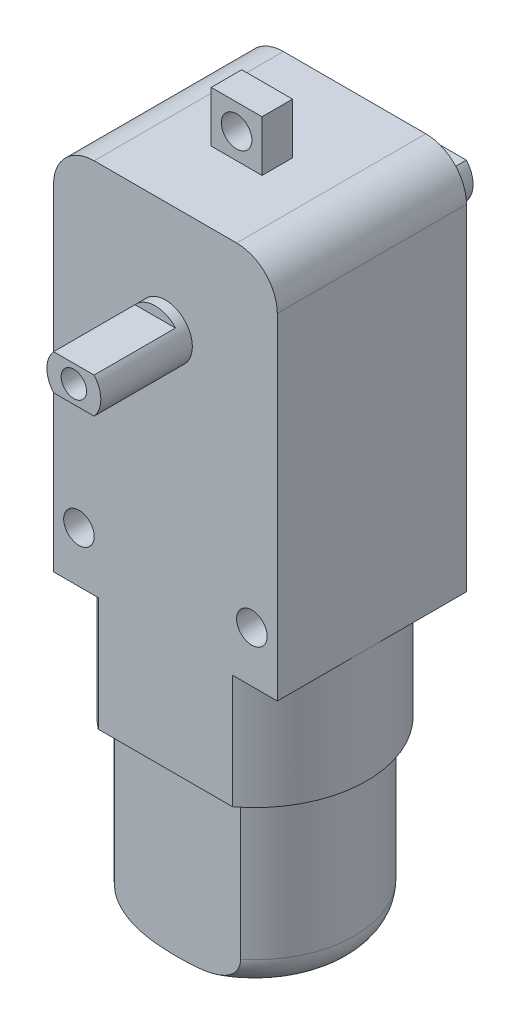
from build123d import *

# Parameters (mm, degrees)
SKETCH1_W                = 22
SKETCH1_H                = 65
BOSS_EXTRUDE1_DEPTH      = 18.6
FILLET1_R                = 4
BOSS_EXTRUDE2_DEPTH      = 9
BOSS_EXTRUDE2_DEPTH_BACK = 27.6
SKETCH2_R                = 2.65
CUT_EXTRUDE1_DEPTH       = 8
CUT_EXTRUDE2_DEPTH       = 8
SKETCH5_R                = 1.25
CUT_EXTRUDE3_DEPTH       = 51.16781837
BOSS_EXTRUDE3_START      = -7
SKETCH6_W                = 5
SKETCH6_H                = 10
SKETCH6_R                = 1.5
BOSS_EXTRUDE3_DEPTH      = 3
SKETCH7_R                = 2.85
SKETCH7_R_2              = 2.65
BOSS_EXTRUDE4_DEPTH      = 0.5
SKETCH8_R                = 2
BOSS_EXTRUDE5_DEPTH      = 2
SKETCH9_R                = 1.5
CUT_EXTRUDE4_DEPTH       = 48.843599363
SKETCH10_W               = 27.728887241
SKETCH10_H               = 31.632468454
CUT_EXTRUDE5_DEPTH       = 1
SKETCH11_R               = 16.996731029
SKETCH11_R_2             = 11
CUT_EXTRUDE6_DEPTH       = 28
CUT_EXTRUDE7_DEPTH       = 16.8
FILLET2_R                = 3


with BuildPart() as part:
    # Sketch1 → Boss-Extrude1 (new body)
    with BuildSketch(Plane.XY):
        Rectangle(SKETCH1_W, SKETCH1_H)
    extrude(amount=BOSS_EXTRUDE1_DEPTH)

    # Fillet1
    fillet1_edges = [part.edges().sort_by_distance(p)[0] for p in [
        (-11, 32.5, 9.3),
        (11, 32.5, 9.3),
    ]]
    fillet(fillet1_edges, radius=FILLET1_R)

    # Sketch2 → Boss-Extrude2 (add, two sides: drawn at the far end of the back side and taken through both)
    with BuildSketch(Plane.XY.offset(18.6).offset(-BOSS_EXTRUDE2_DEPTH_BACK)):
        with Locations((0, 21.5)):
            Circle(SKETCH2_R)
    extrude(amount=BOSS_EXTRUDE2_DEPTH + BOSS_EXTRUDE2_DEPTH_BACK)

    # Sketch3 → Cut-Extrude1 (cut)
    with BuildSketch(Plane.XY.offset(27.6)):
        with BuildLine():
            Line((-1.989974874, 23.25), (1.989974874, 23.25))
            ThreePointArc((1.989974874, 23.25), (0, 24.15), (-1.989974874, 23.25))
        make_face()
        with BuildLine():
            Line((-1.989974874, 19.75), (1.989974874, 19.75))
            ThreePointArc((1.989974874, 19.75), (0, 18.85), (-1.989974874, 19.75))
        make_face()
    extrude(amount=-CUT_EXTRUDE1_DEPTH, mode=Mode.SUBTRACT)

    # Sketch4 → Cut-Extrude2 (cut)
    with BuildSketch(Plane(origin=(0, 0, -9), x_dir=(-1, 0, 0), z_dir=(0, 0, -1))):
        with BuildLine():
            Line((-1.989974874, 19.75), (1.989974874, 19.75))
            ThreePointArc((1.989974874, 19.75), (0, 18.85), (-1.989974874, 19.75))
        make_face()
        with BuildLine():
            Line((1.989974874, 23.25), (-1.989974874, 23.25))
            ThreePointArc((-1.989974874, 23.25), (0, 24.15), (1.989974874, 23.25))
        make_face()
    extrude(amount=-CUT_EXTRUDE2_DEPTH, mode=Mode.SUBTRACT)

    # Sketch5 → Cut-Extrude3 (cut, through all)
    with BuildSketch(Plane(origin=(0, 0, -9), x_dir=(-1, 0, 0), z_dir=(0, 0, -1))):
        with Locations((0, 21.5)):
            Circle(SKETCH5_R)
    extrude(amount=-CUT_EXTRUDE3_DEPTH, mode=Mode.SUBTRACT)

    # Sketch6 → Boss-Extrude3 (add)
    with BuildSketch(Plane.XY.offset(18.6).offset(BOSS_EXTRUDE3_START)):
        with Locations((0, 32.5)):
            Rectangle(SKETCH6_W, SKETCH6_H)
        with Locations((0, 35)):
            Circle(SKETCH6_R, mode=Mode.SUBTRACT)
    extrude(amount=-BOSS_EXTRUDE3_DEPTH)

    # Sketch7 → Boss-Extrude4 (add)
    with BuildSketch(Plane(origin=(0, 0, 0), x_dir=(-1, 0, 0), z_dir=(0, 0, -1))):
        with Locations(Location((0, 21.5, 0), (0, 0, 180))):
            Circle(SKETCH7_R)
        with Locations(Location((0, 21.5, 0), (0, 0, 221.328658646))):
            Circle(SKETCH7_R_2, mode=Mode.SUBTRACT)
    extrude(amount=BOSS_EXTRUDE4_DEPTH)

    # Sketch8 → Boss-Extrude5 (add)
    with BuildSketch(Plane(origin=(0, 0, 0), x_dir=(-1, 0, 0), z_dir=(0, 0, -1))):
        with Locations(Location((0, 10.5, 0), (0, 0, 180))):
            Circle(SKETCH8_R)
    extrude(amount=BOSS_EXTRUDE5_DEPTH)

    # Sketch9 → Cut-Extrude4 (cut, through all)
    with BuildSketch(Plane(origin=(0, 0, 0), x_dir=(-1, 0, 0), z_dir=(0, 0, -1))):
        with Locations((-8.5, 0.5)):
            Circle(SKETCH9_R)
        with Locations(Location((8.5, 0.5, 0), (0, 0, 180))):
            Circle(SKETCH9_R)
    extrude(amount=-CUT_EXTRUDE4_DEPTH, mode=Mode.SUBTRACT)

    # Sketch10 → Cut-Extrude5 (cut)
    with BuildSketch(Plane(origin=(0, 0, 0), x_dir=(-1, 0, 0), z_dir=(0, 0, -1))):
        with Locations((0.201909374, -20.316234227)):
            Rectangle(SKETCH10_W, SKETCH10_H)
    extrude(amount=-CUT_EXTRUDE5_DEPTH, mode=Mode.SUBTRACT)

    # Sketch11 → Cut-Extrude6 (cut)
    with BuildSketch(Plane.XZ.offset(32.5)):
        with Locations((0, 9.8)):
            Circle(SKETCH11_R)
        with Locations((0, 9.8)):
            Circle(SKETCH11_R_2, mode=Mode.SUBTRACT)
    extrude(amount=-CUT_EXTRUDE6_DEPTH, mode=Mode.SUBTRACT)

    # Sketch12 → Cut-Extrude7 (cut)
    with BuildSketch(Plane.XZ.offset(32.5)):
        with BuildLine():
            Line((6.6, 18.6), (-6.6, 18.6))
            ThreePointArc((-6.6, 18.6), (-11, 9.8), (-6.6, 1))
            Line((-6.6, 1), (6.6, 1))
            ThreePointArc((6.6, 1), (11, 9.8), (6.6, 18.6))
        make_face()
        with BuildLine():
            Line((6.187083319, 17.4), (-6.187083319, 17.4))
            ThreePointArc((-6.187083319, 17.4), (-9.8, 9.8), (-6.187083319, 2.2))
            Line((-6.187083319, 2.2), (6.187083319, 2.2))
            ThreePointArc((6.187083319, 2.2), (9.8, 9.8), (6.187083319, 17.4))
        make_face(mode=Mode.SUBTRACT)
    extrude(amount=-CUT_EXTRUDE7_DEPTH, mode=Mode.SUBTRACT)

    # Fillet2
    # the kernel refuses this fillet: 3 mm, written as the material it takes off along each edge
    with BuildSketch(Plane(origin=(0, -32.5, 9.8), x_dir=(-0.08233193306434959, 0, -0.9966049632617165), z_dir=(-0.9966049632617165, 0, 0.08233193306434959))) as fillet2_piece_1:
        with BuildLine():
            CenterArc((9.8 - FILLET2_R, -FILLET2_R), FILLET2_R, 0, 90)
            Line((9.8 - FILLET2_R, 0), (9.8, 0))
            Line((9.8, 0), (9.8, -FILLET2_R))
        make_face()
    revolve(axis=Axis((0, -32.5, 9.8), (0, -1, 0)), revolution_arc=189.445235963, mode=Mode.SUBTRACT)
    with BuildSketch(Plane(origin=(0, -32.5, 9.8), x_dir=(0.08233193306435141, 0, 0.9966049632617163), z_dir=(0.9966049632617163, 0, -0.08233193306435141))) as fillet2_piece_2:
        with BuildLine():
            CenterArc((9.8 - FILLET2_R, -FILLET2_R), FILLET2_R, 0, 90)
            Line((9.8 - FILLET2_R, 0), (9.8, 0))
            Line((9.8, 0), (9.8, -FILLET2_R))
        make_face()
    revolve(axis=Axis((0, -32.5, 9.8), (0, -1, 0)), revolution_arc=189.445235963, mode=Mode.SUBTRACT)


solid = part.part
